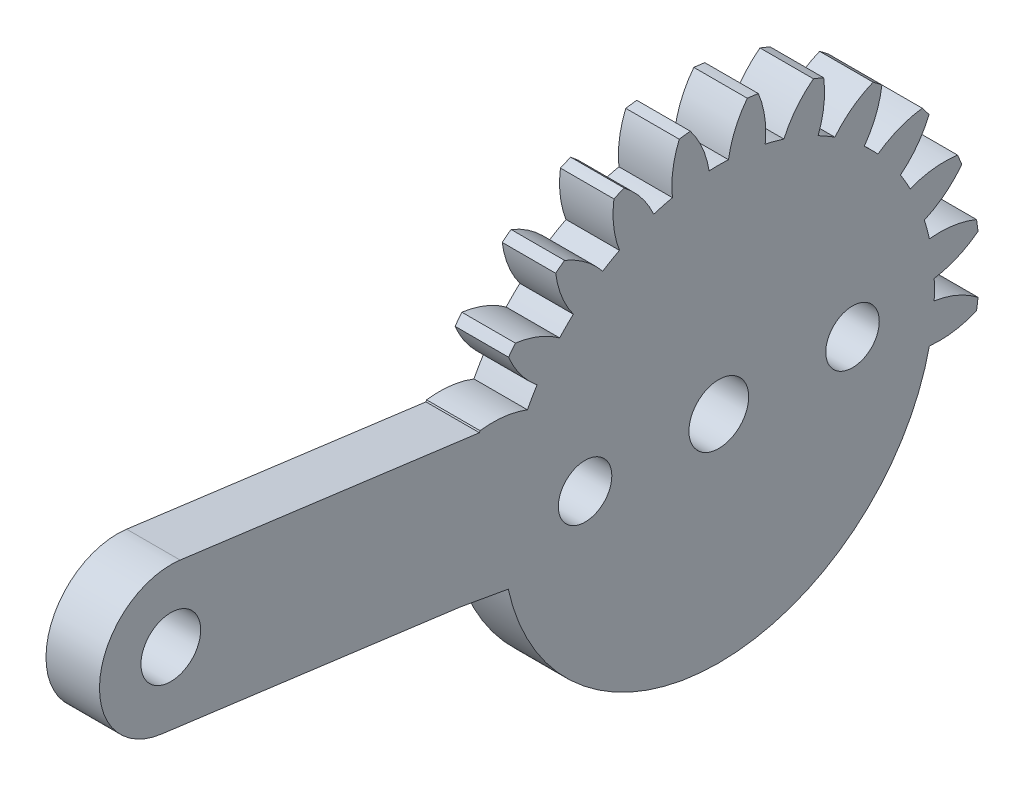
from build123d import *

# Parameters (mm, degrees)
SKETCH1_R           = 1.675
BOSS_EXTRUDE1_DEPTH = 3
SKETCH2_R           = 1.675
BOSS_EXTRUDE2_DEPTH = 3
CUT_EXTRUDE1_START  = -3
CUT_EXTRUDE1_DEPTH  = 3
SKETCH4_R           = 1.5
CUT_EXTRUDE2_DEPTH  = 38.773525245


# Read off the part's stored shape, not the designer's step: Cut-Extrude1
with BuildPart() as part:
    # Sketch1 → Boss-Extrude1 (new body)
    with BuildSketch(Plane(origin=(3, 0, 0), x_dir=(0, 0, -1), z_dir=(1, 0, 0))):
        with BuildLine():
            ThreePointArc((-14.537314892, 1.599093719), (-13.375367565, 0.916420874), (-12.080565177, 0.542722358))
            ThreePointArc((-12.080565177, 0.542722358), (-12.09275, 0), (-12.080565177, -0.542722358))
            ThreePointArc((-12.080565177, -0.542722358), (-13.375367565, -0.916420874), (-14.537314892, -1.599093719))
            ThreePointArc((-14.537314892, -1.599093719), (-14.499881098, -1.908945561), (-14.455843809, -2.217928037))
            ThreePointArc((-14.455843809, -2.217928037), (-13.156800143, -2.576605271), (-11.809396783, -2.602450802))
            ThreePointArc((-11.809396783, -2.602450802), (-11.680699536, -3.129834008), (-11.528463019, -3.650909885))
            ThreePointArc((-11.528463019, -3.650909885), (-12.682425791, -4.346994451), (-13.62809199, -5.30713988))
            ThreePointArc((-13.62809199, -5.30713988), (-13.511738163, -5.596745198), (-13.389230859, -5.883801663))
            ThreePointArc((-13.389230859, -5.883801663), (-12.041618533, -5.894040025), (-10.733437515, -5.57027124))
            ThreePointArc((-10.733437515, -5.57027124), (-10.472628702, -6.046375), (-10.190715157, -6.510293938))
            ThreePointArc((-10.190715157, -6.510293938), (-11.125197659, -7.48132754), (-11.79013714, -8.65351323))
            ThreePointArc((-11.79013714, -8.65351323), (-11.602792602, -8.903135899), (-11.410163953, -9.148703928))
            ThreePointArc((-11.410163953, -9.148703928), (-10.105820521, -8.809805691), (-8.926012217, -8.158486898))
            ThreePointArc((-8.926012217, -8.158486898), (-8.550865528, -8.550865528), (-8.158486898, -8.926012217))
            ThreePointArc((-8.158486898, -8.926012217), (-8.809805691, -10.105820521), (-9.148703928, -11.410163953))
            ThreePointArc((-9.148703928, -11.410163953), (-8.903135899, -11.602792602), (-8.65351323, -11.79013714))
            ThreePointArc((-8.65351323, -11.79013714), (-7.48132754, -11.125197659), (-6.510293938, -10.190715157))
            ThreePointArc((-6.510293938, -10.190715157), (-6.046375, -10.472628702), (-5.57027124, -10.733437515))
            ThreePointArc((-5.57027124, -10.733437515), (-5.894040025, -12.041618533), (-5.883801663, -13.389230859))
            ThreePointArc((-5.883801663, -13.389230859), (-5.596745198, -13.511738163), (-5.30713988, -13.62809199))
            ThreePointArc((-5.30713988, -13.62809199), (-4.346994451, -12.682425791), (-3.650909885, -11.528463019))
            ThreePointArc((-3.650909885, -11.528463019), (-3.129834008, -11.680699536), (-2.602450802, -11.809396783))
            ThreePointArc((-2.602450802, -11.809396783), (-2.576605271, -13.156800143), (-2.217928037, -14.455843809))
            ThreePointArc((-2.217928037, -14.455843809), (-1.908945561, -14.499881098), (-1.599093719, -14.537314892))
            ThreePointArc((-1.599093719, -14.537314892), (-0.916420874, -13.375367565), (-0.542722358, -12.080565177))
            ThreePointArc((-0.542722358, -12.080565177), (0, -12.09275), (0.542722358, -12.080565177))
            ThreePointArc((0.542722358, -12.080565177), (0.916420874, -13.375367565), (1.599093719, -14.537314892))
            ThreePointArc((1.599093719, -14.537314892), (1.908945561, -14.499881098), (2.217928037, -14.455843809))
            ThreePointArc((2.217928037, -14.455843809), (2.576605271, -13.156800143), (2.602450802, -11.809396783))
            ThreePointArc((2.602450802, -11.809396783), (3.129834008, -11.680699536), (3.650909885, -11.528463019))
            ThreePointArc((3.650909885, -11.528463019), (4.346994451, -12.682425791), (5.30713988, -13.62809199))
            ThreePointArc((5.30713988, -13.62809199), (5.596745198, -13.511738163), (5.883801663, -13.389230859))
            ThreePointArc((5.883801663, -13.389230859), (5.894040025, -12.041618533), (5.57027124, -10.733437515))
            ThreePointArc((5.57027124, -10.733437515), (6.046375, -10.472628702), (6.510293938, -10.190715157))
            ThreePointArc((6.510293938, -10.190715157), (7.48132754, -11.125197659), (8.65351323, -11.79013714))
            ThreePointArc((8.65351323, -11.79013714), (8.903135899, -11.602792602), (9.148703928, -11.410163953))
            ThreePointArc((9.148703928, -11.410163953), (8.809805691, -10.105820521), (8.158486898, -8.926012217))
            ThreePointArc((8.158486898, -8.926012217), (8.550865528, -8.550865528), (8.926012217, -8.158486898))
            ThreePointArc((8.926012217, -8.158486898), (10.105820521, -8.809805691), (11.410163953, -9.148703928))
            ThreePointArc((11.410163953, -9.148703928), (11.602792602, -8.903135899), (11.79013714, -8.65351323))
            ThreePointArc((11.79013714, -8.65351323), (11.125197659, -7.48132754), (10.190715157, -6.510293938))
            ThreePointArc((10.190715157, -6.510293938), (10.472628702, -6.046375), (10.733437515, -5.57027124))
            ThreePointArc((10.733437515, -5.57027124), (12.041618533, -5.894040025), (13.389230859, -5.883801663))
            ThreePointArc((13.389230859, -5.883801663), (13.511738163, -5.596745198), (13.62809199, -5.30713988))
            ThreePointArc((13.62809199, -5.30713988), (12.682425791, -4.346994451), (11.528463019, -3.650909885))
            ThreePointArc((11.528463019, -3.650909885), (11.680699536, -3.129834008), (11.809396783, -2.602450802))
            ThreePointArc((11.809396783, -2.602450802), (13.156800143, -2.576605271), (14.455843809, -2.217928037))
            ThreePointArc((14.455843809, -2.217928037), (14.499881098, -1.908945561), (14.537314892, -1.599093719))
            ThreePointArc((14.537314892, -1.599093719), (13.375367565, -0.916420874), (12.080565177, -0.542722358))
            ThreePointArc((12.080565177, -0.542722358), (12.09275, 0), (12.080565177, 0.542722358))
            ThreePointArc((12.080565177, 0.542722358), (13.375367565, 0.916420874), (14.537314892, 1.599093719))
            ThreePointArc((14.537314892, 1.599093719), (14.499881098, 1.908945561), (14.455843809, 2.217928037))
            ThreePointArc((14.455843809, 2.217928037), (13.156800143, 2.576605271), (11.809396783, 2.602450802))
            ThreePointArc((11.809396783, 2.602450802), (11.680699536, 3.129834008), (11.528463019, 3.650909885))
            ThreePointArc((11.528463019, 3.650909885), (12.682425791, 4.346994451), (13.62809199, 5.30713988))
            ThreePointArc((13.62809199, 5.30713988), (13.511738163, 5.596745198), (13.389230859, 5.883801663))
            ThreePointArc((13.389230859, 5.883801663), (12.041618533, 5.894040025), (10.733437515, 5.57027124))
            ThreePointArc((10.733437515, 5.57027124), (10.472628702, 6.046375), (10.190715157, 6.510293938))
            ThreePointArc((10.190715157, 6.510293938), (11.125197659, 7.48132754), (11.79013714, 8.65351323))
            ThreePointArc((11.79013714, 8.65351323), (11.602792602, 8.903135899), (11.410163953, 9.148703928))
            ThreePointArc((11.410163953, 9.148703928), (10.105820521, 8.809805691), (8.926012217, 8.158486898))
            ThreePointArc((8.926012217, 8.158486898), (8.550865528, 8.550865528), (8.158486898, 8.926012217))
            ThreePointArc((8.158486898, 8.926012217), (8.809805691, 10.105820521), (9.148703928, 11.410163953))
            ThreePointArc((9.148703928, 11.410163953), (8.903135899, 11.602792602), (8.65351323, 11.79013714))
            ThreePointArc((8.65351323, 11.79013714), (7.48132754, 11.125197659), (6.510293938, 10.190715157))
            ThreePointArc((6.510293938, 10.190715157), (6.046375, 10.472628702), (5.57027124, 10.733437515))
            ThreePointArc((5.57027124, 10.733437515), (5.894040025, 12.041618533), (5.883801663, 13.389230859))
            ThreePointArc((5.883801663, 13.389230859), (5.596745198, 13.511738163), (5.30713988, 13.62809199))
            ThreePointArc((5.30713988, 13.62809199), (4.346994451, 12.682425791), (3.650909885, 11.528463019))
            ThreePointArc((3.650909885, 11.528463019), (3.129834008, 11.680699536), (2.602450802, 11.809396783))
            ThreePointArc((2.602450802, 11.809396783), (2.576605271, 13.156800143), (2.217928037, 14.455843809))
            ThreePointArc((2.217928037, 14.455843809), (1.908945561, 14.499881098), (1.599093719, 14.537314892))
            ThreePointArc((1.599093719, 14.537314892), (0.916420874, 13.375367565), (0.542722358, 12.080565177))
            ThreePointArc((0.542722358, 12.080565177), (0, 12.09275), (-0.542722358, 12.080565177))
            ThreePointArc((-0.542722358, 12.080565177), (-0.916420874, 13.375367565), (-1.599093719, 14.537314892))
            ThreePointArc((-1.599093719, 14.537314892), (-1.908945561, 14.499881098), (-2.217928037, 14.455843809))
            ThreePointArc((-2.217928037, 14.455843809), (-2.576605271, 13.156800143), (-2.602450802, 11.809396783))
            ThreePointArc((-2.602450802, 11.809396783), (-3.129834008, 11.680699536), (-3.650909885, 11.528463019))
            ThreePointArc((-3.650909885, 11.528463019), (-4.346994451, 12.682425791), (-5.30713988, 13.62809199))
            ThreePointArc((-5.30713988, 13.62809199), (-5.596745198, 13.511738163), (-5.883801663, 13.389230859))
            ThreePointArc((-5.883801663, 13.389230859), (-5.894040025, 12.041618533), (-5.57027124, 10.733437515))
            ThreePointArc((-5.57027124, 10.733437515), (-6.046375, 10.472628702), (-6.510293938, 10.190715157))
            ThreePointArc((-6.510293938, 10.190715157), (-7.48132754, 11.125197659), (-8.65351323, 11.79013714))
            ThreePointArc((-8.65351323, 11.79013714), (-8.903135899, 11.602792602), (-9.148703928, 11.410163953))
            ThreePointArc((-9.148703928, 11.410163953), (-8.809805691, 10.105820521), (-8.158486898, 8.926012217))
            ThreePointArc((-8.158486898, 8.926012217), (-8.550865528, 8.550865528), (-8.926012217, 8.158486898))
            ThreePointArc((-8.926012217, 8.158486898), (-10.105820521, 8.809805691), (-11.410163953, 9.148703928))
            ThreePointArc((-11.410163953, 9.148703928), (-11.602792602, 8.903135899), (-11.79013714, 8.65351323))
            ThreePointArc((-11.79013714, 8.65351323), (-11.125197659, 7.48132754), (-10.190715157, 6.510293938))
            ThreePointArc((-10.190715157, 6.510293938), (-10.472628702, 6.046375), (-10.733437515, 5.57027124))
            ThreePointArc((-10.733437515, 5.57027124), (-12.041618533, 5.894040025), (-13.389230859, 5.883801663))
            ThreePointArc((-13.389230859, 5.883801663), (-13.511738163, 5.596745198), (-13.62809199, 5.30713988))
            ThreePointArc((-13.62809199, 5.30713988), (-12.682425791, 4.346994451), (-11.528463019, 3.650909885))
            ThreePointArc((-11.528463019, 3.650909885), (-11.680699536, 3.129834008), (-11.809396783, 2.602450802))
            ThreePointArc((-11.809396783, 2.602450802), (-13.156800143, 2.576605271), (-14.455843809, 2.217928037))
            ThreePointArc((-14.455843809, 2.217928037), (-14.499881098, 1.908945561), (-14.537314892, 1.599093719))
        make_face()
        with Locations(Location((0, 0, 0), (0, 0, 180))):
            Circle(SKETCH1_R, mode=Mode.SUBTRACT)
    extrude(amount=-BOSS_EXTRUDE1_DEPTH)

    # Sketch2 → Boss-Extrude2 (add)
    with BuildSketch(Plane(origin=(3, 0, 0), x_dir=(0, 0, -1), z_dir=(1, 0, 0))):
        with BuildLine():
            Line((-0.522104769, -3.965779445), (-31.256895471, 0.080532513))
            ThreePointArc((-31.256895471, 0.080532513), (-34.700570148, 4.568416728), (-30.212685934, 8.012091404))
            Line((-30.212685934, 8.012091404), (0.522104769, 3.965779445))
            ThreePointArc((0.522104769, 3.965779445), (3.965779445, -0.522104769), (-0.522104769, -3.965779445))
        make_face()
        with Locations((-30.734790703, 4.046311959)):
            Circle(SKETCH2_R, mode=Mode.SUBTRACT)
        with Locations(Location((0, 0, 0), (0, 0, 180))):
            Circle(SKETCH2_R, mode=Mode.SUBTRACT)
    extrude(amount=-BOSS_EXTRUDE2_DEPTH)

    # Cut-Extrude1 outline → Cut-Extrude1 (cut)
    with BuildSketch(Plane(origin=(3, 0, 0), x_dir=(0, 0, -1), z_dir=(1, 0, 0)).offset(CUT_EXTRUDE1_START)):
        with BuildLine():
            ThreePointArc((-14.455843809, -2.217928037), (-13.156800143, -2.576605271), (-11.809396783, -2.602450802))
            Line((-11.809396783, -2.602450802), (-14.469116823, -2.129620475))
            ThreePointArc((-14.469116823, -2.129620475), (-14.462547716, -2.173784387), (-14.455843809, -2.217928037))
        make_face()
        with BuildLine():
            ThreePointArc((11.528463018, -3.650909885), (11.172244217, -4.627695076), (10.733437514, -5.57027124))
            ThreePointArc((10.733437514, -5.57027124), (12.041618534, -5.894040025), (13.389230859, -5.883801663))
            ThreePointArc((13.389230859, -5.883801663), (13.511738163, -5.596745198), (13.62809199, -5.30713988))
            ThreePointArc((13.62809199, -5.30713988), (12.682425791, -4.346994451), (11.528463018, -3.650909885))
        make_face()
        with BuildLine():
            ThreePointArc((10.190715157, -6.510293938), (9.593823606, -7.361599771), (8.926012217, -8.158486898))
            ThreePointArc((8.926012217, -8.158486898), (10.105820521, -8.809805691), (11.410163953, -9.148703928))
            ThreePointArc((11.410163953, -9.148703928), (11.602792602, -8.903135899), (11.79013714, -8.65351323))
            ThreePointArc((11.79013714, -8.65351323), (11.125197659, -7.48132754), (10.190715157, -6.510293938))
        make_face()
        with BuildLine():
            ThreePointArc((8.158486898, -8.926012217), (7.361599771, -9.593823606), (6.510293938, -10.190715157))
            ThreePointArc((6.510293938, -10.190715157), (7.48132754, -11.125197659), (8.65351323, -11.79013714))
            ThreePointArc((8.65351323, -11.79013714), (8.903135899, -11.602792602), (9.148703928, -11.410163953))
            ThreePointArc((9.148703928, -11.410163953), (8.809805691, -10.105820521), (8.158486898, -8.926012217))
        make_face()
        with BuildLine():
            ThreePointArc((5.57027124, -10.733437514), (4.627695077, -11.172244217), (3.650909885, -11.528463019))
            ThreePointArc((3.650909885, -11.528463019), (4.346994451, -12.682425791), (5.30713988, -13.62809199))
            ThreePointArc((5.30713988, -13.62809199), (5.596745198, -13.511738163), (5.883801663, -13.389230859))
            ThreePointArc((5.883801663, -13.389230859), (5.894040025, -12.041618534), (5.57027124, -10.733437514))
        make_face()
        with BuildLine():
            ThreePointArc((2.602450802, -11.809396783), (1.578420611, -11.989294847), (0.542722358, -12.080565177))
            ThreePointArc((0.542722358, -12.080565177), (0.916420874, -13.375367565), (1.599093719, -14.537314892))
            ThreePointArc((1.599093719, -14.537314892), (1.908945561, -14.499881098), (2.217928037, -14.455843809))
            ThreePointArc((2.217928037, -14.455843809), (2.576605271, -13.156800143), (2.602450802, -11.809396783))
        make_face()
        with BuildLine():
            ThreePointArc((-0.542722358, -12.080565177), (-1.578420611, -11.989294847), (-2.602450802, -11.809396783))
            ThreePointArc((-2.602450802, -11.809396783), (-2.576605271, -13.156800143), (-2.217928037, -14.455843809))
            ThreePointArc((-2.217928037, -14.455843809), (-1.908945561, -14.499881098), (-1.599093719, -14.537314892))
            ThreePointArc((-1.599093719, -14.537314892), (-0.916420874, -13.375367565), (-0.542722358, -12.080565177))
        make_face()
        with BuildLine():
            ThreePointArc((-3.650909885, -11.528463019), (-4.627695077, -11.172244217), (-5.57027124, -10.733437514))
            ThreePointArc((-5.57027124, -10.733437514), (-5.894040025, -12.041618534), (-5.883801663, -13.389230859))
            ThreePointArc((-5.883801663, -13.389230859), (-5.596745198, -13.511738163), (-5.30713988, -13.62809199))
            ThreePointArc((-5.30713988, -13.62809199), (-4.346994451, -12.682425791), (-3.650909885, -11.528463019))
        make_face()
        with BuildLine():
            ThreePointArc((-6.510293938, -10.190715157), (-7.361599771, -9.593823606), (-8.158486898, -8.926012217))
            ThreePointArc((-8.158486898, -8.926012217), (-8.809805691, -10.105820521), (-9.148703928, -11.410163953))
            ThreePointArc((-9.148703928, -11.410163953), (-8.903135899, -11.602792602), (-8.65351323, -11.79013714))
            ThreePointArc((-8.65351323, -11.79013714), (-7.48132754, -11.125197659), (-6.510293938, -10.190715157))
        make_face()
        with BuildLine():
            ThreePointArc((-8.926012217, -8.158486898), (-9.593823606, -7.361599771), (-10.190715157, -6.510293938))
            ThreePointArc((-10.190715157, -6.510293938), (-11.125197659, -7.48132754), (-11.79013714, -8.65351323))
            ThreePointArc((-11.79013714, -8.65351323), (-11.602792602, -8.903135899), (-11.410163953, -9.148703928))
            ThreePointArc((-11.410163953, -9.148703928), (-10.105820521, -8.809805691), (-8.926012217, -8.158486898))
        make_face()
        with BuildLine():
            ThreePointArc((-10.733437514, -5.57027124), (-11.172244217, -4.627695076), (-11.528463018, -3.650909885))
            ThreePointArc((-11.528463018, -3.650909885), (-12.682425791, -4.346994451), (-13.62809199, -5.30713988))
            ThreePointArc((-13.62809199, -5.30713988), (-13.511738163, -5.596745198), (-13.389230859, -5.883801663))
            ThreePointArc((-13.389230859, -5.883801663), (-12.041618534, -5.894040025), (-10.733437514, -5.57027124))
        make_face()
    extrude(amount=CUT_EXTRUDE1_DEPTH, mode=Mode.SUBTRACT)

    # Sketch4 → Cut-Extrude2 (cut, through all)
    with BuildSketch(Plane(origin=(3, 0, 0), x_dir=(0, 0, -1), z_dir=(1, 0, 0))):
        with Locations((-7.5, 0)):
            Circle(SKETCH4_R)
        with Locations((7.5, 0)):
            Circle(SKETCH4_R)
    extrude(amount=-CUT_EXTRUDE2_DEPTH, mode=Mode.SUBTRACT)


solid = part.part
